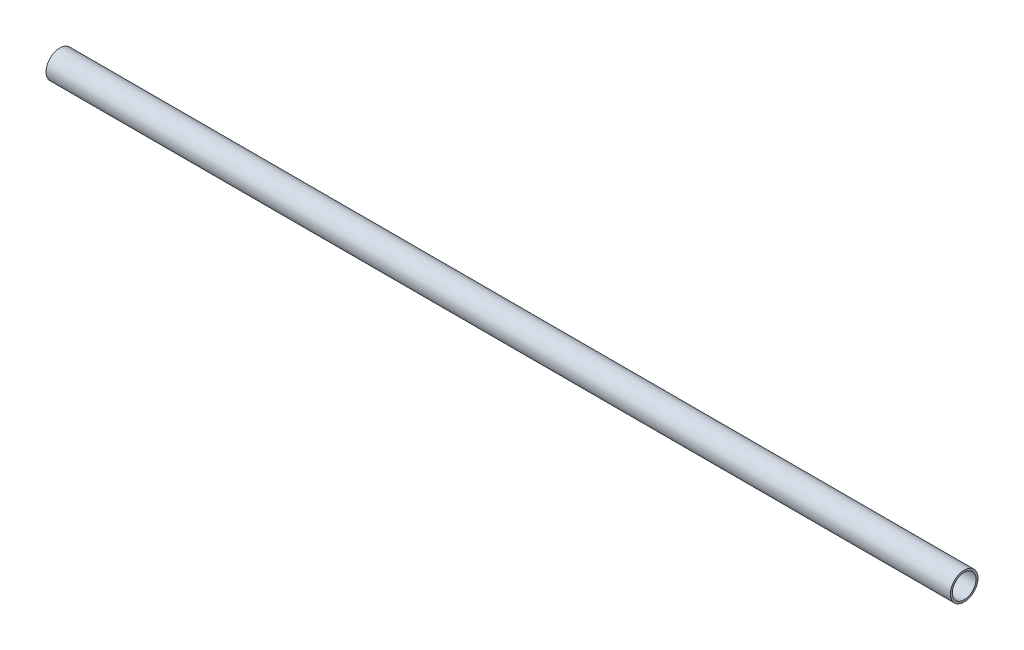
from build123d import *

# Parameters (mm, degrees)
IZIM1_R                     = 7
IZIM1_R_2                   = 6
Y_KSEKLIK_EKSTR_ZYON1_DEPTH = 229


with BuildPart() as part:
    # Çizim1 → Yükseklik-Ekstrüzyon1 (new, symmetric)
    with BuildSketch(Plane(origin=(0, 0, 0), x_dir=(0, 0, -1), z_dir=(1, 0, 0))):
        Circle(IZIM1_R)
        Circle(IZIM1_R_2, mode=Mode.SUBTRACT)
    extrude(amount=Y_KSEKLIK_EKSTR_ZYON1_DEPTH, both=True)


solid = part.part
